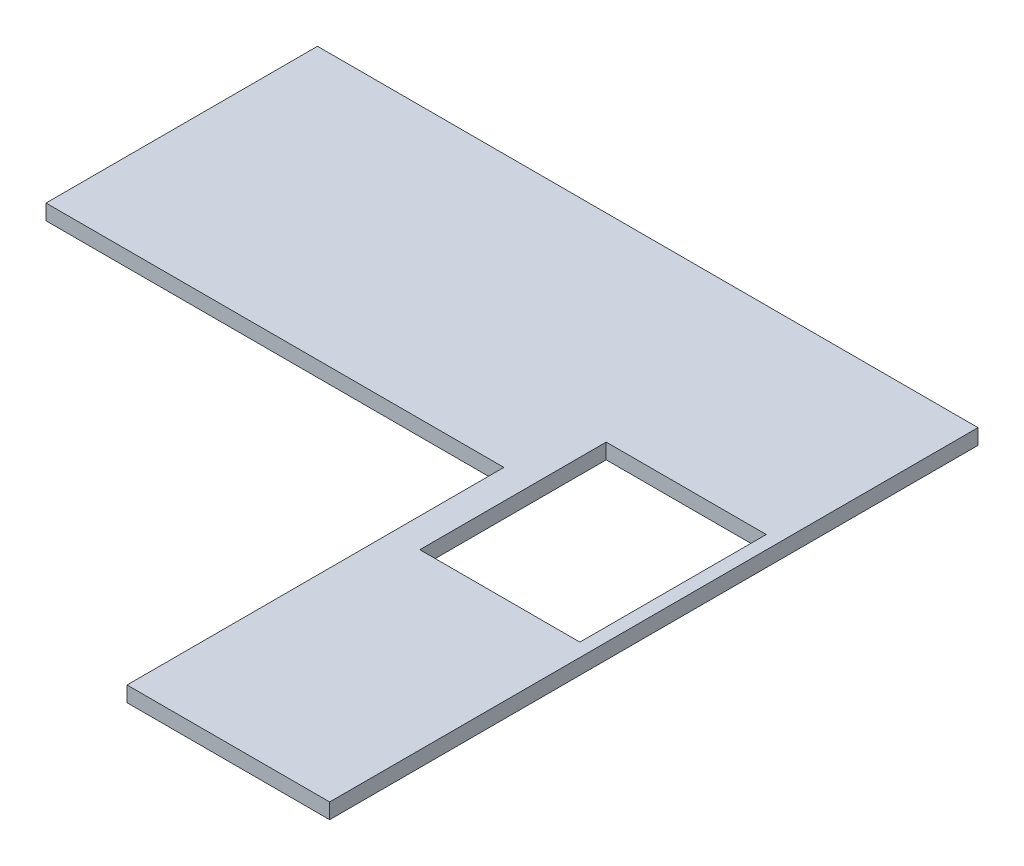
from build123d import *

# Parameters (mm, degrees)
EXTRUDE_1_DEPTH     = 38
SKETCH_2_W          = 395
SKETCH_2_H          = 460
CUT_EXTRUDE_1_DEPTH = 1878.03063374


with BuildPart() as part:
    # Эскиз1 → Бобышка-Вытянуть1 (new body)
    with BuildSketch(Plane(origin=(0, 0, 0), x_dir=(1, 0, 0), z_dir=(0, 1, 0))):
        Polygon((0, 0), (0, 670), (1630, 670), (1630, -930), (1130, -930), (1130, 0), align=None)
    extrude(amount=EXTRUDE_1_DEPTH)

    # Эскиз2 → Вырез-Вытянуть1 (cut, through all)
    with BuildSketch(Plane(origin=(0, 38, 0), x_dir=(1, 0, 0), z_dir=(0, 1, 0))):
        with Locations((1399.663474593, -49.653573833)):
            Rectangle(SKETCH_2_W, SKETCH_2_H)
    extrude(amount=-CUT_EXTRUDE_1_DEPTH, mode=Mode.SUBTRACT)


solid = part.part
